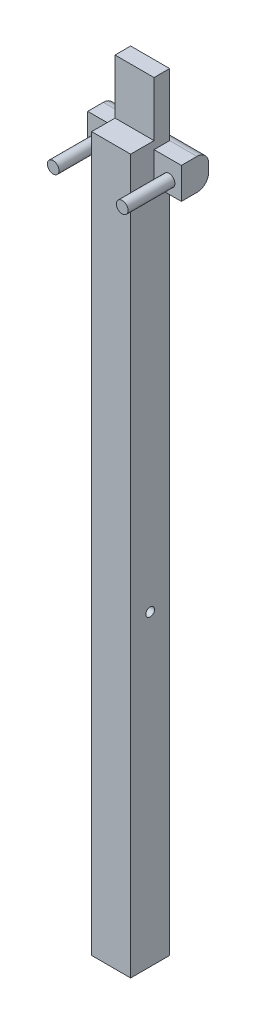
from build123d import *

# Parameters (mm, degrees)
SKETCH1_W           = 254
SKETCH1_H           = 5000
BOSS_EXTRUDE1_DEPTH = 254
SKETCH2_R           = 28.575
CUT_EXTRUDE1_DEPTH  = 2526.674563359
SKETCH4_W           = 254
SKETCH4_H           = 355.6
CUT_EXTRUDE2_DEPTH  = 152.4
BOSS_EXTRUDE2_START = -152.4
SKETCH5_W           = 609.6
SKETCH5_H           = 203.2
BOSS_EXTRUDE2_DEPTH = 101.6
SKETCH8_W           = 76.2
SKETCH8_H           = 203.2
BOSS_EXTRUDE3_DEPTH = 609.6
FILLET1_START       = -304.8
FILLET1_DEPTH       = 609.6
SKETCH9_R           = 38.1
BOSS_EXTRUDE4_DEPTH = 304.8


with BuildPart() as part:
    # Sketch1 → Boss-Extrude1 (new body)
    with BuildSketch(Plane.XY):
        Rectangle(SKETCH1_W, SKETCH1_H)
    extrude(amount=BOSS_EXTRUDE1_DEPTH)

    # Sketch2 → Cut-Extrude1 (cut, through all)
    with BuildSketch(Plane(origin=(127, 0, 0), x_dir=(0, 0, -1), z_dir=(1, 0, 0))):
        with Locations((-127, -500)):
            Circle(SKETCH2_R)
    extrude(amount=-CUT_EXTRUDE1_DEPTH, mode=Mode.SUBTRACT)

    # Sketch4 → Cut-Extrude2 (cut)
    with BuildSketch(Plane.XY.offset(254)):
        with Locations((0, 2322.2)):
            Rectangle(SKETCH4_W, SKETCH4_H)
    extrude(amount=-CUT_EXTRUDE2_DEPTH, mode=Mode.SUBTRACT)

    # Sketch5 → Boss-Extrude2 (add)
    with BuildSketch(Plane.XY.offset(254).offset(BOSS_EXTRUDE2_START)):
        with Locations((0, 1992)):
            Rectangle(SKETCH5_W, SKETCH5_H)
    extrude(amount=-BOSS_EXTRUDE2_DEPTH)

    # Sketch8 → Boss-Extrude3 (add)
    with BuildSketch(Plane.ZY.offset(304.8)):
        with Locations((-38.1, 1992)):
            Rectangle(SKETCH8_W, SKETCH8_H)
    extrude(amount=-BOSS_EXTRUDE3_DEPTH)

    # Fillet1: read off the stored shape, not the designer's step
    # Fillet1 outline → Fillet1 (cut)
    with BuildSketch(Plane.YZ.offset(FILLET1_START)):
        with BuildLine():
            Line((1890.4, -76.2), (1966.6, -76.2))
            ThreePointArc((1966.6, -76.2), (1912.718463274, -53.881536726), (1890.4, 0))
            Line((1890.4, 0), (1890.4, -76.2))
        make_face()
        with BuildLine():
            ThreePointArc((2093.6, 0), (2071.281536726, -53.881536726), (2017.4, -76.2))
            Line((2017.4, -76.2), (2093.6, -76.2))
            Line((2093.6, -76.2), (2093.6, 0))
        make_face()
    extrude(amount=FILLET1_DEPTH, mode=Mode.SUBTRACT)

    # Sketch9 → Boss-Extrude4 (add)
    with BuildSketch(Plane.XY.offset(101.6)):
        with Locations(Location((-224.79, 1970.41, 0), (0, 0, 180))):
            Circle(SKETCH9_R)
        with Locations(Location((224.79, 1970.41, 0), (0, 0, 180))):
            Circle(SKETCH9_R)
    extrude(amount=BOSS_EXTRUDE4_DEPTH)


solid = part.part
